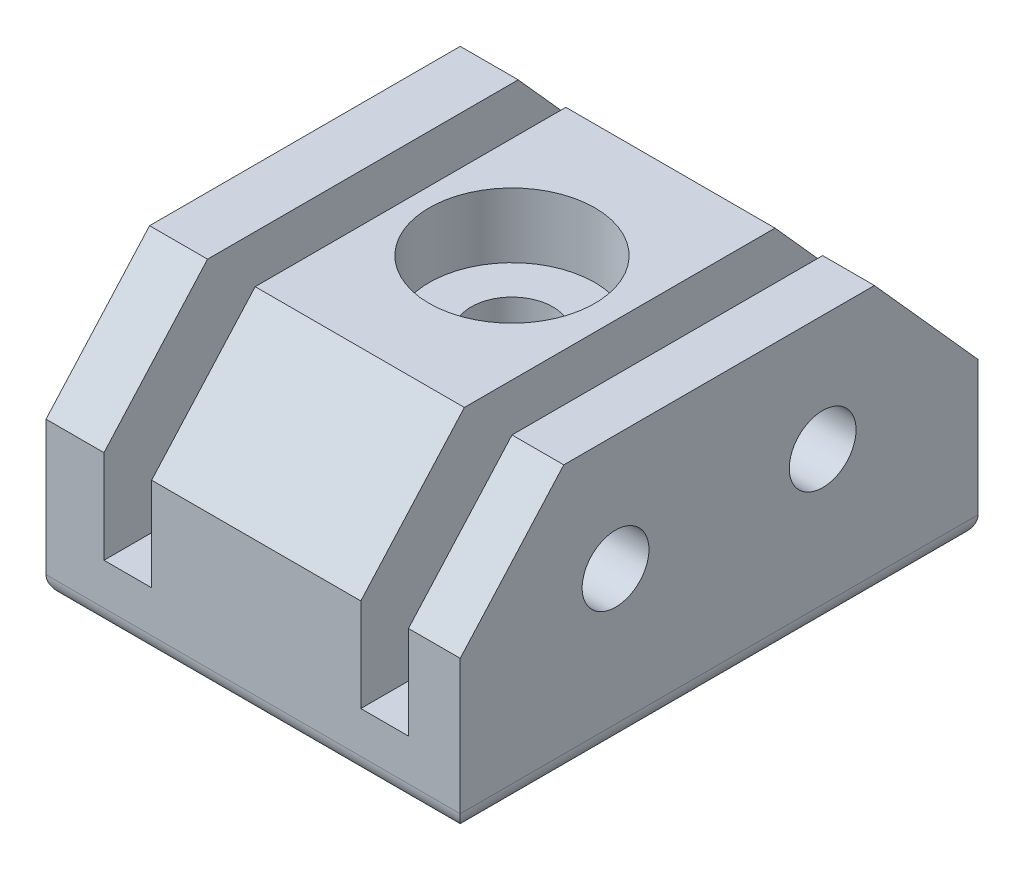
from build123d import *

# Parameters (mm, degrees)
SKETCH1_W           = 63.5
SKETCH1_H           = 6.35
BOSS_EXTRUDE1_DEPTH = 50.8
BOSS_EXTRUDE2_DEPTH = 50.8
SKETCH10_W          = 5.842
SKETCH10_H          = 25.629031657
CUT_EXTRUDE1_DEPTH  = 88.854357354
LPATTERN3_COUNT     = 2
LPATTERN3_PITCH     = 31.496
SKETCH11_R          = 4.09575
CUT_EXTRUDE2_DEPTH  = 88.854357354
FILLET1_R           = 2.54
SKETCH22_R          = 10.16
CUT_EXTRUDE8_DEPTH  = 7.9375
SKETCH24_R          = 5
CUT_EXTRUDE10_DEPTH = 88.854357354
CUT_EXTRUDE11_START = -2.54
SKETCH25_R          = 10.16
CUT_EXTRUDE11_DEPTH = 2.54


with BuildPart() as part:
    # Sketch1 → Boss-Extrude1 (new body)
    with BuildSketch(Plane(origin=(0, 0, 0), x_dir=(0, 0, -1), z_dir=(1, 0, 0))):
        with Locations((31.75, 3.175)):
            Rectangle(SKETCH1_W, SKETCH1_H)
    extrude(amount=-BOSS_EXTRUDE1_DEPTH)

    # Sketch2 → Boss-Extrude2 (add)
    with BuildSketch(Plane(origin=(0, 0, 0), x_dir=(0, 0, -1), z_dir=(1, 0, 0))):
        Polygon((0, 6.35), (0, 19.05), (12.7, 33.249031657), (50.8, 33.249031657), (63.5, 19.05), (63.5, 6.35), align=None)
    extrude(amount=-BOSS_EXTRUDE2_DEPTH)

    # Sketch10 → Cut-Extrude1 (cut, through all)
    with BuildSketch(Plane(origin=(0, 0, -63.5), x_dir=(-1, 0, 0), z_dir=(0, 0, -1))):
        with Locations((9.271, 20.434515829)):
            Rectangle(SKETCH10_W, SKETCH10_H)
    cut_extrude1 = extrude(amount=-CUT_EXTRUDE1_DEPTH, mode=Mode.SUBTRACT)

    # LPattern3: Cut-Extrude1 ×2
    with Locations(*[(-i * LPATTERN3_PITCH, 0, 0) for i in range(1, LPATTERN3_COUNT)]):
        add(cut_extrude1, mode=Mode.SUBTRACT)

    # Sketch11 → Cut-Extrude2 (cut, through all)
    with BuildSketch(Plane(origin=(0, 0, 0), x_dir=(0, 0, -1), z_dir=(1, 0, 0))):
        with Locations((19.05, 19.05)):
            Circle(SKETCH11_R)
        with Locations((44.45, 19.05)):
            Circle(SKETCH11_R)
    extrude(amount=-CUT_EXTRUDE2_DEPTH, mode=Mode.SUBTRACT)

    # Fillet1
    fillet1_edges = [part.edges().sort_by_distance(p)[0] for p in [
        (0, 0, -31.75),
        (-50.8, 0, -31.75),
        (-25.4, 0, 0),
        (-25.4, 0, -63.5),
    ]]
    fillet(fillet1_edges, radius=FILLET1_R)

    # Sketch22 → Cut-Extrude8 (cut)
    with BuildSketch(Plane.XZ.offset(-33.249031657)):
        with Locations((-25.4, -31.75)):
            Circle(SKETCH22_R)
    extrude(amount=CUT_EXTRUDE8_DEPTH, mode=Mode.SUBTRACT)

    # Sketch24 → Cut-Extrude10 (cut, through all)
    with BuildSketch(Plane.XZ):
        with Locations((-25.4, -31.75)):
            Circle(SKETCH24_R)
    extrude(amount=-CUT_EXTRUDE10_DEPTH, mode=Mode.SUBTRACT)

    # Sketch25 → Cut-Extrude11 (cut)
    with BuildSketch(Plane.XZ.offset(CUT_EXTRUDE11_START)):
        with Locations((-25.4, -31.75)):
            Circle(SKETCH25_R)
    extrude(amount=CUT_EXTRUDE11_DEPTH, mode=Mode.SUBTRACT)


solid = part.part
